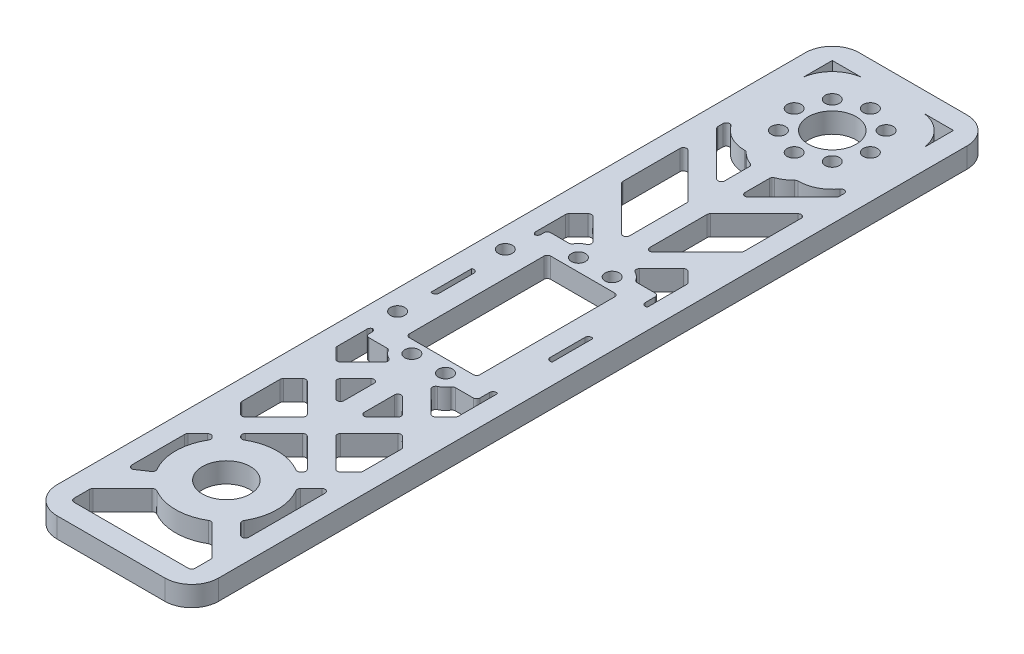
from build123d import *

# Parameters (mm, degrees)
SKETCH1_W           = 48
SKETCH1_H           = 238.294372516
SKETCH1_R           = 7.1
SKETCH1_R_2         = 2.1
SKETCH1_W_2         = 21
SKETCH1_H_2         = 42
BOSS_EXTRUDE1_DEPTH = 6
FILLET2_R           = 8
FILLET3_START       = -1
FILLET3_DEPTH       = 8
FILLET3_2_DEPTH     = 6


with BuildPart() as part:
    # Sketch1 → Boss-Extrude1 (new body)
    with BuildSketch(Plane(origin=(0, 0, 0), x_dir=(1, 0, 0), z_dir=(0, 1, 0))):
        Rectangle(SKETCH1_W, SKETCH1_H)
        with Locations(Location((0, 95.147186258, 0), (0, 0, 270))):
            Circle(SKETCH1_R, mode=Mode.SUBTRACT)
        with Locations(Location((0, -84.852813742, 0), (0, 0, 270))):
            Circle(SKETCH1_R, mode=Mode.SUBTRACT)
        with Locations(Location((-8, 103.147186258, 0), (0, 0, 270))):
            Circle(SKETCH1_R_2, mode=Mode.SUBTRACT)
        with Locations(Location((8, 103.147186258, 0), (0, 0, 270))):
            Circle(SKETCH1_R_2, mode=Mode.SUBTRACT)
        with Locations(Location((8, 87.147186258, 0), (0, 0, 270))):
            Circle(SKETCH1_R_2, mode=Mode.SUBTRACT)
        with Locations(Location((-8, 87.147186258, 0), (0, 0, 270))):
            Circle(SKETCH1_R_2, mode=Mode.SUBTRACT)
        with Locations(Location((0, 106.460894757, 0), (0, 0, 270))):
            Circle(SKETCH1_R_2, mode=Mode.SUBTRACT)
        with Locations(Location((11.313708499, 95.147186258, 0), (0, 0, 270))):
            Circle(SKETCH1_R_2, mode=Mode.SUBTRACT)
        with Locations(Location((0, 83.833477759, 0), (0, 0, 270))):
            Circle(SKETCH1_R_2, mode=Mode.SUBTRACT)
        with Locations(Location((-11.313708499, 95.147186258, 0), (0, 0, 270))):
            Circle(SKETCH1_R_2, mode=Mode.SUBTRACT)
        with Locations(Location((-18, 16, 0), (0, 0, 270))):
            Circle(SKETCH1_R_2, mode=Mode.SUBTRACT)
        with Locations(Location((-18, -16, 0), (0, 0, 270))):
            Circle(SKETCH1_R_2, mode=Mode.SUBTRACT)
        with Locations(Location((5, 24.75, 0), (0, 0, 270))):
            Circle(SKETCH1_R_2, mode=Mode.SUBTRACT)
        with Locations(Location((-5, 24.75, 0), (0, 0, 270))):
            Circle(SKETCH1_R_2, mode=Mode.SUBTRACT)
        with Locations(Location((5, -24.75, 0), (0, 0, 270))):
            Circle(SKETCH1_R_2, mode=Mode.SUBTRACT)
        with Locations(Location((-5, -24.75, 0), (0, 0, 270))):
            Circle(SKETCH1_R_2, mode=Mode.SUBTRACT)
        Polygon((-18, 70.325901808), (-18, 50.526911935), (-3, 35.526911935), (-3, 55.325901808), align=None, mode=Mode.SUBTRACT)
        Polygon((3, 55.325901808), (18, 70.325901808), (18, 50.526911935), (3, 35.526911935), align=None, mode=Mode.SUBTRACT)
        with BuildLine():
            Line((-18, 78.811183182), (-3, 63.811183182))
            Line((-3, 63.811183182), (-3, 74.189308536))
            ThreePointArc((-3, 74.189308536), (-5.438798895, 75.322927449), (-7.491969734, 77.059971317))
            ThreePointArc((-7.491969734, 77.059971317), (-14.427620164, 79.356441811), (-18, 85.72944157))
            Line((-18, 85.72944157), (-18, 78.811183182))
        make_face(mode=Mode.SUBTRACT)
        with BuildLine():
            Line((3, 74.189308536), (3, 63.811183182))
            Line((3, 63.811183182), (18, 78.811183182))
            Line((18, 78.811183182), (18, 85.72944157))
            ThreePointArc((18, 85.72944157), (14.427620164, 79.356441811), (7.491969734, 77.059971317))
            ThreePointArc((7.491969734, 77.059971317), (5.438798895, 75.322927449), (3, 74.189308536))
        make_face(mode=Mode.SUBTRACT)
        Polygon((-3, -35.526911935), (-9.899494937, -42.426406871), (-3, -49.325901808), align=None, mode=Mode.SUBTRACT)
        Polygon((3, -35.526911935), (3, -49.325901808), (9.899494937, -42.426406871), align=None, mode=Mode.SUBTRACT)
        Polygon((-14.142135624, -46.669047558), (-18, -50.526911935), (-18, -62.610173055), (-14.142135624, -66.468037432), (-4.242640687, -56.568542495), align=None, mode=Mode.SUBTRACT)
        Polygon((4.242640687, -56.568542495), (14.142135624, -46.669047558), (18, -50.526911935), (18, -62.610173055), (14.142135624, -66.468037432), align=None, mode=Mode.SUBTRACT)
        with BuildLine():
            Line((0, -60.811183182), (-9.899494937, -70.710678119))
            Line((-9.899494937, -70.710678119), (-8.343143331, -72.267029724))
            ThreePointArc((-8.343143331, -72.267029724), (0, -69.752813742), (8.343143331, -72.267029724))
            Line((8.343143331, -72.267029724), (9.899494937, -70.710678119))
            Line((9.899494937, -70.710678119), (0, -60.811183182))
        make_face(mode=Mode.SUBTRACT)
        with BuildLine():
            Line((-14.142135624, -74.953318806), (-18, -78.811183182))
            Line((-18, -78.811183182), (-18, -96.852813742))
            Line((-18, -96.852813742), (-12.585784018, -93.195957074))
            ThreePointArc((-12.585784018, -93.195957074), (-15.1, -84.852813742), (-12.585784018, -76.509670411))
            Line((-12.585784018, -76.509670411), (-14.142135624, -74.953318806))
        make_face(mode=Mode.SUBTRACT)
        with BuildLine():
            Line((-18, -107.09545443), (-18, -113.147186258))
            Line((-18, -113.147186258), (18, -113.147186258))
            Line((18, -113.147186258), (18, -107.09545443))
            Line((18, -107.09545443), (8.343143331, -97.438597761))
            ThreePointArc((8.343143331, -97.438597761), (0, -99.952813742), (-8.343143331, -97.438597761))
            Line((-8.343143331, -97.438597761), (-18, -107.09545443))
        make_face(mode=Mode.SUBTRACT)
        with BuildLine():
            Line((12.585784018, -93.195957074), (18, -98.610173055))
            Line((18, -98.610173055), (18, -71.09545443))
            Line((18, -71.09545443), (12.585784018, -76.509670411))
            ThreePointArc((12.585784018, -76.509670411), (15.1, -84.852813742), (12.585784018, -93.195957074))
        make_face(mode=Mode.SUBTRACT)
        Rectangle(SKETCH1_W_2, SKETCH1_H_2, mode=Mode.SUBTRACT)
        with BuildLine():
            Line((9.417744688, 113.147186258), (18, 113.147186258))
            Line((18, 113.147186258), (18, 104.564930945))
            ThreePointArc((18, 104.564930945), (15.14177849, 110.288964748), (9.417744688, 113.147186258))
        make_face(mode=Mode.SUBTRACT)
        with BuildLine():
            Line((-9.417744688, 113.147186258), (-18, 113.147186258))
            Line((-18, 113.147186258), (-18, 104.564930945))
            ThreePointArc((-18, 104.564930945), (-15.14177849, 110.288964748), (-9.417744688, 113.147186258))
        make_face(mode=Mode.SUBTRACT)
        with BuildLine():
            Line((16.5, 27), (16.5, 20.742640687))
            Line((16.5, 20.742640687), (18, 22.242640687))
            Line((18, 22.242640687), (18, 34.325901808))
            Line((18, 34.325901808), (14.142135624, 38.183766184))
            Line((14.142135624, 38.183766184), (5.752542321, 29.794172881))
            ThreePointArc((5.752542321, 29.794172881), (8.008727284, 28.867955819), (9.576843891, 27))
            Line((9.576843891, 27), (16.5, 27))
        make_face(mode=Mode.SUBTRACT)
        with BuildLine():
            Line((-14.142135624, 38.183766184), (-18, 34.325901808))
            Line((-18, 34.325901808), (-18, 24.1))
            ThreePointArc((-18, 24.1), (-17.246735745, 24.064898819), (-16.5, 23.959899497))
            Line((-16.5, 23.959899497), (-16.5, 27))
            Line((-16.5, 27), (-9.576843891, 27))
            ThreePointArc((-9.576843891, 27), (-8.008727284, 28.867955819), (-5.752542321, 29.794172881))
            Line((-5.752542321, 29.794172881), (-14.142135624, 38.183766184))
        make_face(mode=Mode.SUBTRACT)
        Polygon((-16.5, 7.54163056), (-18, 6.04163056), (-18, -6.04163056), (-16.5, -7.54163056), align=None, mode=Mode.SUBTRACT)
        Polygon((16.5, 7.54163056), (18, 6.04163056), (18, -6.04163056), (16.5, -7.54163056), align=None, mode=Mode.SUBTRACT)
        with BuildLine():
            Line((-18, -34.325901808), (-14.142135624, -38.183766184))
            Line((-14.142135624, -38.183766184), (-5.752542321, -29.794172881))
            ThreePointArc((-5.752542321, -29.794172881), (-8.008727284, -28.867955819), (-9.576843891, -27))
            Line((-9.576843891, -27), (-16.5, -27))
            Line((-16.5, -27), (-16.5, -23.959899497))
            ThreePointArc((-16.5, -23.959899497), (-17.246735745, -24.064898819), (-18, -24.1))
            Line((-18, -24.1), (-18, -34.325901808))
        make_face(mode=Mode.SUBTRACT)
        with BuildLine():
            Line((14.142135624, -38.183766184), (18, -34.325901808))
            Line((18, -34.325901808), (18, -22.242640687))
            Line((18, -22.242640687), (16.5, -20.742640687))
            Line((16.5, -20.742640687), (16.5, -27))
            Line((16.5, -27), (9.576843891, -27))
            ThreePointArc((9.576843891, -27), (8.008727284, -28.867955819), (5.752542321, -29.794172881))
            Line((5.752542321, -29.794172881), (14.142135624, -38.183766184))
        make_face(mode=Mode.SUBTRACT)
    extrude(amount=BOSS_EXTRUDE1_DEPTH)

    # Fillet2
    fillet2_edges = [part.edges().sort_by_distance(p)[0] for p in [
        (24, 3, 119.147186258),
        (-24, 3, 119.147186258),
        (-24, 3, -119.147186258),
        (24, 3, -119.147186258),
    ]]
    fillet(fillet2_edges, radius=FILLET2_R)

    # Fillet3: read off the stored shape, not the designer's step
    # Fillet3 outline → Fillet3 (cut)
    with BuildSketch(Plane(origin=(0, 0, 0), x_dir=(1, 0, 0), z_dir=(0, 1, 0)).offset(FILLET3_START)):
        with BuildLine():
            Line((16.5, -27), (16.5, -26))
            ThreePointArc((16.5, -26), (16.207106781, -26.707106781), (15.5, -27))
            Line((15.5, -27), (16.5, -27))
        make_face()
        with BuildLine():
            Line((-16.5, 27), (-16.5, 26))
            ThreePointArc((-16.5, 26), (-16.207106781, 26.707106781), (-15.5, 27))
            Line((-15.5, 27), (-16.5, 27))
        make_face()
        with BuildLine():
            ThreePointArc((15.5, 27), (16.207106781, 26.707106781), (16.5, 26))
            Line((16.5, 26), (16.5, 27))
            Line((16.5, 27), (15.5, 27))
        make_face()
        with BuildLine():
            ThreePointArc((-15.5, -27), (-16.207106781, -26.707106781), (-16.5, -26))
            Line((-16.5, -26), (-16.5, -27))
            Line((-16.5, -27), (-15.5, -27))
        make_face()
    extrude(amount=FILLET3_DEPTH, mode=Mode.SUBTRACT)

    # Fillet3 2 outline → Fillet3 2 (add)
    with BuildSketch(Plane(origin=(0, 0, 0), x_dir=(1, 0, 0), z_dir=(0, 1, 0))):
        with BuildLine():
            ThreePointArc((17.911437828, -22.245416422), (17.977608773, -22.446423534), (18, -22.656854249))
            Line((18, -22.656854249), (18, -22.242640687))
            Line((18, -22.242640687), (16.5, -20.742640687))
            Line((16.5, -20.742640687), (16.5, -23.156854249))
            ThreePointArc((16.5, -23.156854249), (16.957523193, -22.31678347), (17.911437828, -22.245416422))
        make_face()
        with BuildLine():
            Line((18, -34.325901808), (18, -33.911688245))
            ThreePointArc((18, -33.911688245), (17.923879533, -34.294371678), (17.707106781, -34.618795027))
            Line((17.707106781, -34.618795027), (18, -34.325901808))
        make_face()
        with BuildLine():
            Line((14.142135624, -38.183766184), (14.849242405, -37.476659403))
            ThreePointArc((14.849242405, -37.476659403), (14.142135624, -37.769552622), (13.435028843, -37.476659403))
            Line((13.435028843, -37.476659403), (14.142135624, -38.183766184))
        make_face()
        with BuildLine():
            ThreePointArc((9.315872205, -27.467213115), (9.678793034, -27.124561), (10.162121657, -27))
            Line((10.162121657, -27), (9.576843891, -27))
            ThreePointArc((9.576843891, -27), (9.452490529, -27.237031984), (9.315872205, -27.467213115))
        make_face()
        with BuildLine():
            Line((5.752542321, -29.794172881), (6.920524334, -30.962154894))
            ThreePointArc((6.920524334, -30.962154894), (6.642051788, -30.085834074), (7.196871916, -29.352581209))
            ThreePointArc((7.196871916, -29.352581209), (6.491144489, -29.627139337), (5.752542321, -29.794172881))
        make_face()
        with BuildLine():
            ThreePointArc((9.5, 21), (10.207106781, 20.707106781), (10.5, 20))
            Line((10.5, 20), (10.5, 21))
            Line((10.5, 21), (9.5, 21))
        make_face()
        with BuildLine():
            Line((10.5, -21), (10.5, -20))
            ThreePointArc((10.5, -20), (10.207106781, -20.707106781), (9.5, -21))
            Line((9.5, -21), (10.5, -21))
        make_face()
        with BuildLine():
            ThreePointArc((-10.5, 20), (-10.207106781, 20.707106781), (-9.5, 21))
            Line((-9.5, 21), (-10.5, 21))
            Line((-10.5, 21), (-10.5, 20))
        make_face()
        with BuildLine():
            Line((-10.5, -21), (-9.5, -21))
            ThreePointArc((-9.5, -21), (-10.207106781, -20.707106781), (-10.5, -20))
            Line((-10.5, -20), (-10.5, -21))
        make_face()
        with BuildLine():
            ThreePointArc((-16.5, 25.086253353), (-16.735085823, 24.442121145), (-17.329812604, 24.100841637))
            ThreePointArc((-17.329812604, 24.100841637), (-17.815417869, 24.466015277), (-18, 25.044888059))
            Line((-18, 25.044888059), (-18, 24.1))
            ThreePointArc((-18, 24.1), (-17.246735745, 24.064898819), (-16.5, 23.959899497))
            Line((-16.5, 23.959899497), (-16.5, 25.086253353))
        make_face()
        with BuildLine():
            Line((-18, 34.325901808), (-18, 33.911688245))
            ThreePointArc((-18, 33.911688245), (-17.923879532, 34.294371678), (-17.707106781, 34.618795027))
            Line((-17.707106781, 34.618795027), (-18, 34.325901808))
        make_face()
        with BuildLine():
            Line((-14.142135624, 38.183766184), (-14.849242405, 37.476659403))
            ThreePointArc((-14.849242405, 37.476659403), (-14.142135624, 37.769552622), (-13.435028843, 37.476659403))
            Line((-13.435028843, 37.476659403), (-14.142135624, 38.183766184))
        make_face()
        with BuildLine():
            ThreePointArc((-9.315872205, 27.467213115), (-9.678793034, 27.124561), (-10.162121657, 27))
            Line((-10.162121657, 27), (-9.576843891, 27))
            ThreePointArc((-9.576843891, 27), (-9.452490529, 27.237031984), (-9.315872205, 27.467213115))
        make_face()
        with BuildLine():
            Line((-5.752542321, 29.794172881), (-6.920524334, 30.962154894))
            ThreePointArc((-6.920524334, 30.962154894), (-6.642051788, 30.085834074), (-7.196871916, 29.352581209))
            ThreePointArc((-7.196871916, 29.352581209), (-6.491144489, 29.627139337), (-5.752542321, 29.794172881))
        make_face()
        with BuildLine():
            ThreePointArc((17.707106781, 34.618795027), (17.923879533, 34.294371678), (18, 33.911688245))
            Line((18, 33.911688245), (18, 34.325901808))
            Line((18, 34.325901808), (17.707106781, 34.618795027))
        make_face()
        with BuildLine():
            Line((16.5, 20.742640687), (18, 22.242640687))
            ThreePointArc((18, 22.242640687), (17, 22.242640687), (16.5, 23.108666091))
            Line((16.5, 23.108666091), (16.5, 20.742640687))
        make_face()
        with BuildLine():
            ThreePointArc((13.435028843, 37.476659403), (14.142135624, 37.769552622), (14.849242405, 37.476659403))
            Line((14.849242405, 37.476659403), (14.142135624, 38.183766184))
            Line((14.142135624, 38.183766184), (13.435028843, 37.476659403))
        make_face()
        with BuildLine():
            ThreePointArc((7.196871916, 29.352581209), (6.642051788, 30.085834074), (6.920524334, 30.962154894))
            Line((6.920524334, 30.962154894), (5.752542321, 29.794172881))
            ThreePointArc((5.752542321, 29.794172881), (6.491144489, 29.627139337), (7.196871916, 29.352581209))
        make_face()
        with BuildLine():
            Line((9.576843891, 27), (10.162121657, 27))
            ThreePointArc((10.162121657, 27), (9.678793034, 27.124561), (9.315872205, 27.467213115))
            ThreePointArc((9.315872205, 27.467213115), (9.452490529, 27.237031984), (9.576843891, 27))
        make_face()
        with BuildLine():
            Line((-18, -24.1), (-18, -25.044888059))
            ThreePointArc((-18, -25.044888059), (-17.815417869, -24.466015277), (-17.329812604, -24.100841637))
            ThreePointArc((-17.329812604, -24.100841637), (-16.735085823, -24.442121145), (-16.5, -25.086253353))
            Line((-16.5, -25.086253353), (-16.5, -23.959899497))
            ThreePointArc((-16.5, -23.959899497), (-17.246735745, -24.064898819), (-18, -24.1))
        make_face()
        with BuildLine():
            ThreePointArc((-17.707106781, -34.618795027), (-17.923879533, -34.294371678), (-18, -33.911688245))
            Line((-18, -33.911688245), (-18, -34.325901808))
            Line((-18, -34.325901808), (-17.707106781, -34.618795027))
        make_face()
        with BuildLine():
            ThreePointArc((-13.435028843, -37.476659403), (-14.142135624, -37.769552622), (-14.849242405, -37.476659403))
            Line((-14.849242405, -37.476659403), (-14.142135624, -38.183766184))
            Line((-14.142135624, -38.183766184), (-13.435028843, -37.476659403))
        make_face()
        with BuildLine():
            Line((-9.576843891, -27), (-10.162121657, -27))
            ThreePointArc((-10.162121657, -27), (-9.678793034, -27.124561), (-9.315872205, -27.467213115))
            ThreePointArc((-9.315872205, -27.467213115), (-9.452490529, -27.237031984), (-9.576843891, -27))
        make_face()
        with BuildLine():
            ThreePointArc((-7.196871916, -29.352581209), (-6.642051788, -30.085834074), (-6.920524334, -30.962154894))
            Line((-6.920524334, -30.962154894), (-5.752542321, -29.794172881))
            ThreePointArc((-5.752542321, -29.794172881), (-6.491144489, -29.627139337), (-7.196871916, -29.352581209))
        make_face()
        with BuildLine():
            Line((-16.5, -7.54163056), (-16.5, -5.175605157))
            ThreePointArc((-16.5, -5.175605157), (-17, -6.04163056), (-18, -6.04163056))
            Line((-18, -6.04163056), (-16.5, -7.54163056))
        make_face()
        with BuildLine():
            ThreePointArc((-18, 6.04163056), (-17, 6.04163056), (-16.5, 5.175605157))
            Line((-16.5, 5.175605157), (-16.5, 7.54163056))
            Line((-16.5, 7.54163056), (-18, 6.04163056))
        make_face()
        with BuildLine():
            ThreePointArc((18, -6.04163056), (17, -6.04163056), (16.5, -5.175605157))
            Line((16.5, -5.175605157), (16.5, -7.54163056))
            Line((16.5, -7.54163056), (18, -6.04163056))
        make_face()
        with BuildLine():
            Line((16.5, 7.54163056), (16.5, 5.175605156))
            ThreePointArc((16.5, 5.175605156), (17, 6.04163056), (18, 6.04163056))
            Line((18, 6.04163056), (16.5, 7.54163056))
        make_face()
        with BuildLine():
            ThreePointArc((18, 79.225396744), (17.923879533, 78.842713312), (17.707106781, 78.518289963))
            Line((17.707106781, 78.518289963), (18, 78.811183182))
            Line((18, 78.811183182), (18, 79.225396744))
        make_face()
        with BuildLine():
            Line((3, 63.811183182), (4.707106781, 65.518289963))
            ThreePointArc((4.707106781, 65.518289963), (3.617316568, 65.301517212), (3, 66.225396744))
            Line((3, 66.225396744), (3, 63.811183182))
        make_face()
        with BuildLine():
            ThreePointArc((16.189189189, 81.235572229), (17.307562343, 81.601791841), (18, 80.650263909))
            Line((18, 80.650263909), (18, 85.72944157))
            ThreePointArc((18, 85.72944157), (17.368050291, 83.372317552), (16.189189189, 81.235572229))
        make_face()
        with BuildLine():
            Line((3, 74.189308536), (3, 73.479251568))
            ThreePointArc((3, 73.479251568), (3.175269632, 74.044777713), (3.63963964, 74.412064739))
            ThreePointArc((3.63963964, 74.412064739), (3.321687631, 74.295323258), (3, 74.189308536))
        make_face()
        with BuildLine():
            ThreePointArc((7.198599705, 76.748976203), (7.528648916, 76.971419938), (7.919320425, 77.0475085))
            ThreePointArc((7.919320425, 77.0475085), (7.705579128, 77.051478439), (7.491969734, 77.059971317))
            ThreePointArc((7.491969734, 77.059971317), (7.346930454, 76.902921294), (7.198599705, 76.748976203))
        make_face()
        with BuildLine():
            Line((-18, 85.72944157), (-18, 80.650263909))
            ThreePointArc((-18, 80.650263909), (-17.307562343, 81.601791841), (-16.189189189, 81.235572229))
            ThreePointArc((-16.189189189, 81.235572229), (-17.368050291, 83.372317552), (-18, 85.72944157))
        make_face()
        with BuildLine():
            ThreePointArc((-17.707106781, 78.518289963), (-17.923879533, 78.842713312), (-18, 79.225396744))
            Line((-18, 79.225396744), (-18, 78.811183182))
            Line((-18, 78.811183182), (-17.707106781, 78.518289963))
        make_face()
        with BuildLine():
            ThreePointArc((-7.491969734, 77.059971317), (-7.705579128, 77.051478439), (-7.919320425, 77.0475085))
            ThreePointArc((-7.919320425, 77.0475085), (-7.528648916, 76.971419938), (-7.198599705, 76.748976203))
            ThreePointArc((-7.198599705, 76.748976203), (-7.346930454, 76.902921294), (-7.491969734, 77.059971317))
        make_face()
        with BuildLine():
            ThreePointArc((-3, 66.225396744), (-3.617316568, 65.301517212), (-4.707106781, 65.518289963))
            Line((-4.707106781, 65.518289963), (-3, 63.811183182))
            Line((-3, 63.811183182), (-3, 66.225396744))
        make_face()
        with BuildLine():
            ThreePointArc((-3, 74.189308536), (-3.321687631, 74.295323258), (-3.63963964, 74.412064739))
            ThreePointArc((-3.63963964, 74.412064739), (-3.175269632, 74.044777713), (-3, 73.479251568))
            Line((-3, 73.479251568), (-3, 74.189308536))
        make_face()
        with BuildLine():
            ThreePointArc((4.707106781, 37.234018716), (3.617316567, 37.017245964), (3, 37.941125497))
            Line((3, 37.941125497), (3, 35.526911935))
            Line((3, 35.526911935), (4.707106781, 37.234018716))
        make_face()
        with BuildLine():
            Line((3, 55.325901808), (3, 54.911688245))
            ThreePointArc((3, 54.911688245), (3.076120467, 55.294371678), (3.292893219, 55.618795027))
            Line((3.292893219, 55.618795027), (3, 55.325901808))
        make_face()
        with BuildLine():
            ThreePointArc((18, 50.941125497), (17.923879533, 50.558442065), (17.707106781, 50.234018716))
            Line((17.707106781, 50.234018716), (18, 50.526911935))
            Line((18, 50.526911935), (18, 50.941125497))
        make_face()
        with BuildLine():
            Line((18, 70.325901808), (16.292893219, 68.618795027))
            ThreePointArc((16.292893219, 68.618795027), (17.382683433, 68.835567778), (18, 67.911688245))
            Line((18, 67.911688245), (18, 70.325901808))
        make_face()
        with BuildLine():
            ThreePointArc((-3, 37.941125497), (-3.617316567, 37.017245964), (-4.707106781, 37.234018716))
            Line((-4.707106781, 37.234018716), (-3, 35.526911935))
            Line((-3, 35.526911935), (-3, 37.941125497))
        make_face()
        with BuildLine():
            Line((-18, 50.526911935), (-17.707106781, 50.234018716))
            ThreePointArc((-17.707106781, 50.234018716), (-17.923879533, 50.558442065), (-18, 50.941125497))
            Line((-18, 50.941125497), (-18, 50.526911935))
        make_face()
        with BuildLine():
            ThreePointArc((-3.292893219, 55.618795027), (-3.076120467, 55.294371678), (-3, 54.911688245))
            Line((-3, 54.911688245), (-3, 55.325901808))
            Line((-3, 55.325901808), (-3.292893219, 55.618795027))
        make_face()
        with BuildLine():
            Line((-18, 70.325901808), (-18, 67.911688245))
            ThreePointArc((-18, 67.911688245), (-17.382683433, 68.835567778), (-16.292893219, 68.618795027))
            Line((-16.292893219, 68.618795027), (-18, 70.325901808))
        make_face()
        with BuildLine():
            ThreePointArc((-9.192388155, -43.133513652), (-9.485281374, -42.426406871), (-9.192388155, -41.71930009))
            Line((-9.192388155, -41.71930009), (-9.899494937, -42.426406871))
            Line((-9.899494937, -42.426406871), (-9.192388155, -43.133513652))
        make_face()
        with BuildLine():
            Line((-3, -35.526911935), (-4.707106781, -37.234018716))
            ThreePointArc((-4.707106781, -37.234018716), (-3.617316567, -37.017245964), (-3, -37.941125497))
            Line((-3, -37.941125497), (-3, -35.526911935))
        make_face()
        with BuildLine():
            ThreePointArc((-3, -46.911688245), (-3.617316567, -47.835567778), (-4.707106781, -47.618795027))
            Line((-4.707106781, -47.618795027), (-3, -49.325901808))
            Line((-3, -49.325901808), (-3, -46.911688245))
        make_face()
        with BuildLine():
            ThreePointArc((4.707106781, -47.618795027), (3.617316567, -47.835567778), (3, -46.911688245))
            Line((3, -46.911688245), (3, -49.325901808))
            Line((3, -49.325901808), (4.707106781, -47.618795027))
        make_face()
        with BuildLine():
            Line((3, -35.526911935), (3, -37.941125497))
            ThreePointArc((3, -37.941125497), (3.617316567, -37.017245964), (4.707106781, -37.234018716))
            Line((4.707106781, -37.234018716), (3, -35.526911935))
        make_face()
        with BuildLine():
            ThreePointArc((9.192388155, -41.71930009), (9.485281374, -42.426406871), (9.192388155, -43.133513652))
            Line((9.192388155, -43.133513652), (9.899494937, -42.426406871))
            Line((9.899494937, -42.426406871), (9.192388155, -41.71930009))
        make_face()
        with BuildLine():
            ThreePointArc((4.949747468, -57.275649276), (4.656854249, -56.568542495), (4.949747468, -55.861435714))
            Line((4.949747468, -55.861435714), (4.242640687, -56.568542495))
            Line((4.242640687, -56.568542495), (4.949747468, -57.275649276))
        make_face()
        with BuildLine():
            Line((14.142135624, -46.669047558), (13.435028843, -47.376154339))
            ThreePointArc((13.435028843, -47.376154339), (14.142135624, -47.083261121), (14.849242405, -47.376154339))
            Line((14.849242405, -47.376154339), (14.142135624, -46.669047558))
        make_face()
        with BuildLine():
            ThreePointArc((14.849242405, -65.76093065), (14.142135624, -66.053823869), (13.435028843, -65.76093065))
            Line((13.435028843, -65.76093065), (14.142135624, -66.468037432))
            Line((14.142135624, -66.468037432), (14.849242405, -65.76093065))
        make_face()
        with BuildLine():
            Line((18, -50.526911935), (17.707106781, -50.234018716))
            ThreePointArc((17.707106781, -50.234018716), (17.923879533, -50.558442065), (18, -50.941125497))
            Line((18, -50.941125497), (18, -50.526911935))
        make_face()
        with BuildLine():
            ThreePointArc((18, -62.195959493), (17.923879533, -62.578642925), (17.707106781, -62.903066274))
            Line((17.707106781, -62.903066274), (18, -62.610173055))
            Line((18, -62.610173055), (18, -62.195959493))
        make_face()
        with BuildLine():
            ThreePointArc((-13.435028843, -65.76093065), (-14.142135624, -66.053823869), (-14.849242405, -65.76093065))
            Line((-14.849242405, -65.76093065), (-14.142135624, -66.468037432))
            Line((-14.142135624, -66.468037432), (-13.435028843, -65.76093065))
        make_face()
        with BuildLine():
            Line((-18, -62.610173055), (-17.707106781, -62.903066274))
            ThreePointArc((-17.707106781, -62.903066274), (-17.923879533, -62.578642925), (-18, -62.195959493))
            Line((-18, -62.195959493), (-18, -62.610173055))
        make_face()
        with BuildLine():
            ThreePointArc((-4.949747468, -55.861435714), (-4.656854249, -56.568542495), (-4.949747468, -57.275649276))
            Line((-4.949747468, -57.275649276), (-4.242640687, -56.568542495))
            Line((-4.242640687, -56.568542495), (-4.949747468, -55.861435714))
        make_face()
        with BuildLine():
            Line((-18, -50.526911935), (-18, -50.941125497))
            ThreePointArc((-18, -50.941125497), (-17.923879533, -50.558442065), (-17.707106781, -50.234018716))
            Line((-17.707106781, -50.234018716), (-18, -50.526911935))
        make_face()
        with BuildLine():
            ThreePointArc((-14.849242405, -47.376154339), (-14.142135624, -47.083261121), (-13.435028843, -47.376154339))
            Line((-13.435028843, -47.376154339), (-14.142135624, -46.669047558))
            Line((-14.142135624, -46.669047558), (-14.849242405, -47.376154339))
        make_face()
        with BuildLine():
            Line((8.343143331, -72.267029724), (8.906145367, -71.704027688))
            ThreePointArc((8.906145367, -71.704027688), (8.324247533, -71.989051301), (7.689781531, -71.857535369))
            ThreePointArc((7.689781531, -71.857535369), (8.019076712, -72.058111374), (8.343143331, -72.267029724))
        make_face()
        with BuildLine():
            ThreePointArc((9.192388155, -70.003571337), (9.485281374, -70.710678118), (9.192388155, -71.4177849))
            Line((9.192388155, -71.4177849), (9.899494937, -70.710678119))
            Line((9.899494937, -70.710678119), (9.192388155, -70.003571337))
        make_face()
        with BuildLine():
            ThreePointArc((-8.343143331, -72.267029724), (-8.019076712, -72.058111374), (-7.689781531, -71.857535369))
            ThreePointArc((-7.689781531, -71.857535369), (-8.324247533, -71.989051301), (-8.906145367, -71.704027688))
            Line((-8.906145367, -71.704027688), (-8.343143331, -72.267029724))
        make_face()
        with BuildLine():
            ThreePointArc((-0.707106781, -61.518289963), (0, -61.225396744), (0.707106781, -61.518289963))
            Line((0.707106781, -61.518289963), (0, -60.811183182))
            Line((0, -60.811183182), (-0.707106781, -61.518289963))
        make_face()
        with BuildLine():
            Line((-9.899494937, -70.710678119), (-9.192388155, -71.4177849))
            ThreePointArc((-9.192388155, -71.4177849), (-9.485281374, -70.710678118), (-9.192388155, -70.003571337))
            Line((-9.192388155, -70.003571337), (-9.899494937, -70.710678119))
        make_face()
        with BuildLine():
            ThreePointArc((-18, -79.225396744), (-17.923879533, -78.842713312), (-17.707106781, -78.518289963))
            Line((-17.707106781, -78.518289963), (-18, -78.811183182))
            Line((-18, -78.811183182), (-18, -79.225396744))
        make_face()
        with BuildLine():
            Line((-14.142135624, -74.953318806), (-14.849242405, -75.660425587))
            ThreePointArc((-14.849242405, -75.660425587), (-14.142135624, -75.367532368), (-13.435028843, -75.660425587))
            Line((-13.435028843, -75.660425587), (-14.142135624, -74.953318806))
        make_face()
        with BuildLine():
            ThreePointArc((-16.440289438, -95.799357805), (-17.469195822, -95.853763785), (-18, -94.970669633))
            Line((-18, -94.970669633), (-18, -96.852813742))
            Line((-18, -96.852813742), (-16.440289438, -95.799357805))
        make_face()
        with BuildLine():
            Line((-12.585784018, -76.509670411), (-13.148786054, -75.946668375))
            ThreePointArc((-13.148786054, -75.946668375), (-12.863762441, -76.528566209), (-12.995278374, -77.163032211))
            ThreePointArc((-12.995278374, -77.163032211), (-12.794702368, -76.83373703), (-12.585784018, -76.509670411))
        make_face()
        with BuildLine():
            ThreePointArc((-13.075771695, -92.404912429), (-12.967258553, -93.129619995), (-13.382006279, -93.733739588))
            Line((-13.382006279, -93.733739588), (-12.585784018, -93.195957074))
            ThreePointArc((-12.585784018, -93.195957074), (-12.836872606, -92.804209952), (-13.075771695, -92.404912429))
        make_face()
        with BuildLine():
            ThreePointArc((18, -96.195959493), (17.382683432, -97.119839025), (16.292893219, -96.903066274))
            Line((16.292893219, -96.903066274), (18, -98.610173055))
            Line((18, -98.610173055), (18, -96.195959493))
        make_face()
        with BuildLine():
            Line((12.585784018, -93.195957074), (13.148786054, -93.758959109))
            ThreePointArc((13.148786054, -93.758959109), (12.863762441, -93.177061275), (12.995278374, -92.542595273))
            ThreePointArc((12.995278374, -92.542595273), (12.794702368, -92.871890455), (12.585784018, -93.195957074))
        make_face()
        with BuildLine():
            ThreePointArc((16.292893219, -72.802561211), (17.382683433, -72.585788459), (18, -73.509667992))
            Line((18, -73.509667992), (18, -71.09545443))
            Line((18, -71.09545443), (16.292893219, -72.802561211))
        make_face()
        with BuildLine():
            ThreePointArc((12.585784018, -76.509670411), (12.794702368, -76.83373703), (12.995278373, -77.163032211))
            ThreePointArc((12.995278373, -77.163032211), (12.863762441, -76.528566209), (13.148786054, -75.946668375))
            Line((13.148786054, -75.946668375), (12.585784018, -76.509670411))
        make_face()
        with BuildLine():
            ThreePointArc((-17, -113.147186258), (-17.707106781, -112.854293039), (-18, -112.147186258))
            Line((-18, -112.147186258), (-18, -113.147186258))
            Line((-18, -113.147186258), (-17, -113.147186258))
        make_face()
        with BuildLine():
            Line((-18, -107.09545443), (-18, -107.509667992))
            ThreePointArc((-18, -107.509667992), (-17.923879533, -107.12698456), (-17.707106781, -106.802561211))
            Line((-17.707106781, -106.802561211), (-18, -107.09545443))
        make_face()
        with BuildLine():
            ThreePointArc((18, -112.147186258), (17.707106781, -112.854293039), (17, -113.147186258))
            Line((17, -113.147186258), (18, -113.147186258))
            Line((18, -113.147186258), (18, -112.147186258))
        make_face()
        with BuildLine():
            Line((-8.343143331, -97.438597761), (-8.906145367, -98.001599797))
            ThreePointArc((-8.906145367, -98.001599797), (-8.324247534, -97.716576183), (-7.689781531, -97.848092116))
            ThreePointArc((-7.689781531, -97.848092116), (-8.019076712, -97.647516111), (-8.343143331, -97.438597761))
        make_face()
        with BuildLine():
            ThreePointArc((17.707106781, -106.802561211), (17.923879533, -107.12698456), (18, -107.509667992))
            Line((18, -107.509667992), (18, -107.09545443))
            Line((18, -107.09545443), (17.707106781, -106.802561211))
        make_face()
        with BuildLine():
            ThreePointArc((8.343143331, -97.438597761), (8.019076712, -97.647516111), (7.689781531, -97.848092116))
            ThreePointArc((7.689781531, -97.848092116), (8.324247534, -97.716576183), (8.906145367, -98.001599797))
            Line((8.906145367, -98.001599797), (8.343143331, -97.438597761))
        make_face()
    extrude(amount=FILLET3_2_DEPTH)


solid = part.part
